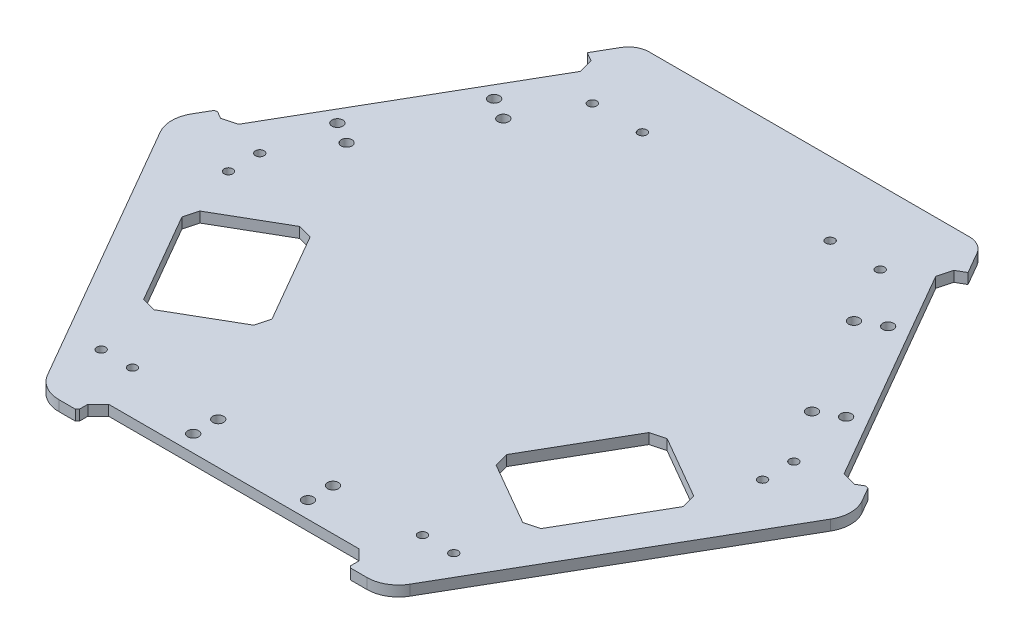
from build123d import *

# Parameters (mm, degrees)
EXTRUDE_1_DEPTH            = 5
SKETCH_2_W                 = 130
SKETCH_2_H                 = 10
CUT_EXTRUDE_1_DEPTH        = 5
SKETCH_9_R                 = 2.6
CUT_EXTRUDE_8_DEPTH        = 219.331742997
PATTERN_CIRCULAR_1_COUNT   = 3
SKETCH_4_R                 = 2.1
CUT_EXTRUDE_4_DEPTH        = 219.331742997
SKETCH_5_R                 = 2.1
CUT_EXTRUDE_5_DEPTH        = 219.331742997
CUT_EXTRUDE_7_DEPTH        = 219.331742997
CHAMFER_2_SIZE             = 5
CHAMFER_2_OF_MIRROR_1_SIZE = 5
CHAMFER_1_SIZE             = 5
FILLET_2_R                 = 15
CHAMFER_3_SIZE             = 1
SKETCH_15_R                = 2.1
CUT_EXTRUDE_15_DEPTH       = 217.583395238
FILLET_3_R                 = 10


with BuildPart() as part:
    # 草圖1 → 填料-伸長1 (new body)
    with BuildSketch(Plane(origin=(0, 0, 0), x_dir=(1, 0, 0), z_dir=(0, 1, 0))):
        Polygon((82.5, 142.894191624), (-82.5, 142.894191624), (-165, 0), (-82.5, -142.894191624), (82.5, -142.894191624), (165, 0), align=None)
    extrude(amount=EXTRUDE_1_DEPTH)

    # 草圖2 → 除料-伸長1 (cut)
    with BuildSketch(Plane(origin=(0, 5, 0), x_dir=(1, 0, 0), z_dir=(0, 1, 0))):
        with Locations((0, -137.894191624)):
            Rectangle(SKETCH_2_W, SKETCH_2_H)
    cut_extrude_1 = extrude(amount=-CUT_EXTRUDE_1_DEPTH, mode=Mode.SUBTRACT)

    # 草圖9 → 除料-伸長8 (cut, symmetric)
    with BuildSketch(Plane(origin=(0, 5, 0), x_dir=(1, 0, 0), z_dir=(0, 1, 0))):
        with Locations((-27.5, -124.894191624)):
            Circle(SKETCH_9_R)
        with Locations((-27.5, -112.894191624)):
            Circle(SKETCH_9_R)
        with Locations((27.5, -112.894191624)):
            Circle(SKETCH_9_R)
        with Locations((27.5, -124.894191624)):
            Circle(SKETCH_9_R)
    cut_extrude_8 = extrude(amount=CUT_EXTRUDE_8_DEPTH, both=True, mode=Mode.SUBTRACT)

    # 環狀複製排列1: 除料-伸長1, 除料-伸長8 ×3 about axis
    pattern_circular_1_axis = Axis((0, 142.894191624, 0), (0, -1, 0))
    add([cut_extrude_1.rotate(pattern_circular_1_axis, i * 360 / PATTERN_CIRCULAR_1_COUNT) for i in range(1, PATTERN_CIRCULAR_1_COUNT)], mode=Mode.SUBTRACT)
    add([cut_extrude_8.rotate(pattern_circular_1_axis, i * 360 / PATTERN_CIRCULAR_1_COUNT) for i in range(1, PATTERN_CIRCULAR_1_COUNT)], mode=Mode.SUBTRACT)

    # 草圖4 → 除料-伸長4 (cut, through all)
    with BuildSketch(Plane(origin=(0, 5, 0), x_dir=(1, 0, 0), z_dir=(0, 1, 0))):
        with Locations((-128, 7.5)):
            Circle(SKETCH_4_R)
        with Locations((-128, -7.5)):
            Circle(SKETCH_4_R)
    cut_extrude_4 = extrude(amount=-CUT_EXTRUDE_4_DEPTH, mode=Mode.SUBTRACT)

    # 草圖5 → 除料-伸長5 (cut, through all)
    with BuildSketch(Plane(origin=(0, 5, 0), x_dir=(1, 0, 0), z_dir=(0, 1, 0))):
        with Locations((-84.5, -112)):
            Circle(SKETCH_5_R)
        with Locations((-69.5, -112)):
            Circle(SKETCH_5_R)
        with Locations((84.5, -112)):
            Circle(SKETCH_5_R)
        with Locations((69.5, -112)):
            Circle(SKETCH_5_R)
    extrude(amount=-CUT_EXTRUDE_5_DEPTH, mode=Mode.SUBTRACT)

    # 草圖8 → 除料-伸長7 (cut, through all)
    with BuildSketch(Plane(origin=(0, 5, 0), x_dir=(1, 0, 0), z_dir=(0, 1, 0))):
        Polygon((-122.679491924, -33.301270189), (-92.679491924, -85.262794416), (-53.708348754, -62.762794416), (-83.708348754, -10.801270189), align=None)
    cut_extrude_7 = extrude(amount=-CUT_EXTRUDE_7_DEPTH, mode=Mode.SUBTRACT)

    # 導角2
    chamfer_2_edges = [part.edges().sort_by_distance(p)[0] for p in [
        (-53.708348754, 2.5, 62.762794416),
        (-92.679491924, 2.5, 85.262794416),
        (-122.679491924, 2.5, 33.301270189),
        (-83.708348754, 2.5, 10.801270189),
    ]]
    chamfer(chamfer_2_edges, length=CHAMFER_2_SIZE)

    # 鏡射1: 除料-伸長4, 除料-伸長7 across plane
    add(cut_extrude_4.mirror(Plane(origin=(0, 0, 0), x_dir=(0, 0, 1), z_dir=(1, 0, 0))), mode=Mode.SUBTRACT)
    add(cut_extrude_7.mirror(Plane(origin=(0, 0, 0), x_dir=(0, 0, 1), z_dir=(1, 0, 0))), mode=Mode.SUBTRACT)

    # 導角2 of 鏡射1
    chamfer_2_of_mirror_1_edges = [part.edges().sort_by_distance(p)[0] for p in [
        (53.708348754, 2.5, 62.762794416),
        (92.679491924, 2.5, 85.262794416),
        (122.679491924, 2.5, 33.301270189),
        (83.708348754, 2.5, 10.801270189),
    ]]
    chamfer(chamfer_2_of_mirror_1_edges, length=CHAMFER_2_OF_MIRROR_1_SIZE)

    # 導角1
    chamfer_1_edges = [part.edges().sort_by_distance(p)[0] for p in [
        (147.589745962, 2.5, -10.155444566),
        (65, 2.5, 132.894191624),
        (-65, 2.5, 132.894191624),
        (-147.589745962, 2.5, -10.155444566),
        (82.589745962, 2.5, -122.738747058),
        (-82.589745962, 2.5, -122.738747058),
    ]]
    chamfer(chamfer_1_edges, length=CHAMFER_1_SIZE)

    # 圓角2
    fillet_2_edges = [part.edges().sort_by_distance(p)[0] for p in [
        (-165, 2.5, 0),
        (-82.5, 2.5, 142.894191624),
        (82.5, 2.5, 142.894191624),
        (165, 2.5, 0),
    ]]
    fillet(fillet_2_edges, radius=FILLET_2_R)

    # 導角3
    chamfer_3_edges = [part.edges().sort_by_distance(p)[0] for p in [
        (65, 2.5, 142.894191624),
        (-65, 2.5, 142.894191624),
        (156.25, 2.5, -15.155444566),
        (-156.25, 2.5, -15.155444566),
    ]]
    chamfer(chamfer_3_edges, length=CHAMFER_3_SIZE)

    # 草圖15 → 除料-伸長15 (cut, through all)
    with BuildSketch(Plane(origin=(0, 5, 0), x_dir=(1, 0, 0), z_dir=(0, 1, 0))):
        with Locations((-69, 107.894191624)):
            Circle(SKETCH_15_R)
        with Locations((-45, 107.894191624)):
            Circle(SKETCH_15_R)
    cut_extrude_15 = extrude(amount=-CUT_EXTRUDE_15_DEPTH, mode=Mode.SUBTRACT)

    # 鏡射2: 除料-伸長15 across plane
    add(cut_extrude_15.mirror(Plane(origin=(0, 0, 0), x_dir=(0, 0, 1), z_dir=(1, 0, 0))), mode=Mode.SUBTRACT)

    # 圓角3
    fillet_3_edges = [part.edges().sort_by_distance(p)[0] for p in [
        (82.5, 2.5, -142.894191624),
        (-82.5, 2.5, -142.894191624),
    ]]
    fillet(fillet_3_edges, radius=FILLET_3_R)


solid = part.part
